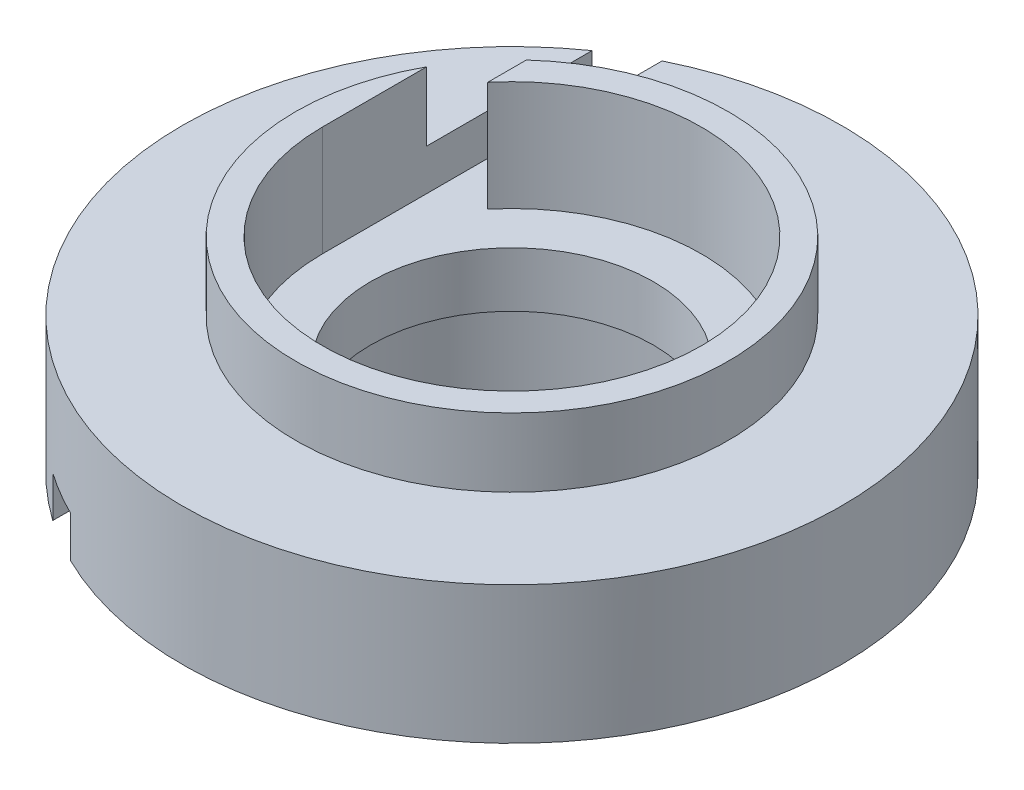
from build123d import *

# Parameters (mm, degrees)
SKETCH1_R           = 30.48
SKETCH1_R_2         = 13.081
BOSS_EXTRUDE1_DEPTH = 12.7
CUT_EXTRUDE1_DEPTH  = 10.16
SKETCH13_R          = 30.48
SKETCH13_R_2        = 20
CUT_EXTRUDE2_DEPTH  = 6.35
CIRPATTERN1_COUNT   = 2


with BuildPart() as part:
    # Sketch1 → Boss-Extrude1 (new, symmetric)
    with BuildSketch(Plane(origin=(0, 0, 0), x_dir=(1, 0, 0), z_dir=(0, 1, 0))):
        Circle(SKETCH1_R)
        Circle(SKETCH1_R_2, mode=Mode.SUBTRACT)
    extrude(amount=BOSS_EXTRUDE1_DEPTH, both=True)

    # Sketch2 → Cut-Extrude1 (cut)
    with BuildSketch(Plane(origin=(0, 12.7, 0), x_dir=(1, 0, 0), z_dir=(0, 1, 0))):
        with BuildLine():
            Line((-17.526, 0), (-17.526, 24.937315894))
            ThreePointArc((-17.526, 24.937315894), (-15.54073689, 26.220524345), (-13.462, 27.346022672))
            Line((-13.462, 27.346022672), (-13.462, 11.222086793))
            ThreePointArc((-13.462, 11.222086793), (16.478708809, -5.967648783), (-17.526, 0))
        make_face()
    cut_extrude1 = extrude(amount=-CUT_EXTRUDE1_DEPTH, mode=Mode.SUBTRACT)

    # Sketch13 → Cut-Extrude2 (cut)
    with BuildSketch(Plane(origin=(0, 12.7, 0), x_dir=(1, 0, 0), z_dir=(0, 1, 0))):
        Circle(SKETCH13_R)
        Circle(SKETCH13_R_2, mode=Mode.SUBTRACT)
    cut_extrude2 = extrude(amount=-CUT_EXTRUDE2_DEPTH, mode=Mode.SUBTRACT)

    # CirPattern1: Cut-Extrude1, Cut-Extrude2 ×2 about axis
    cirpattern1_axis = Axis((-0.555253774, 0, 0), (-1, 0, 0))
    add([cut_extrude1.rotate(cirpattern1_axis, i * 360 / CIRPATTERN1_COUNT) for i in range(1, CIRPATTERN1_COUNT)], mode=Mode.SUBTRACT)
    add([cut_extrude2.rotate(cirpattern1_axis, i * 360 / CIRPATTERN1_COUNT) for i in range(1, CIRPATTERN1_COUNT)], mode=Mode.SUBTRACT)


solid = part.part
